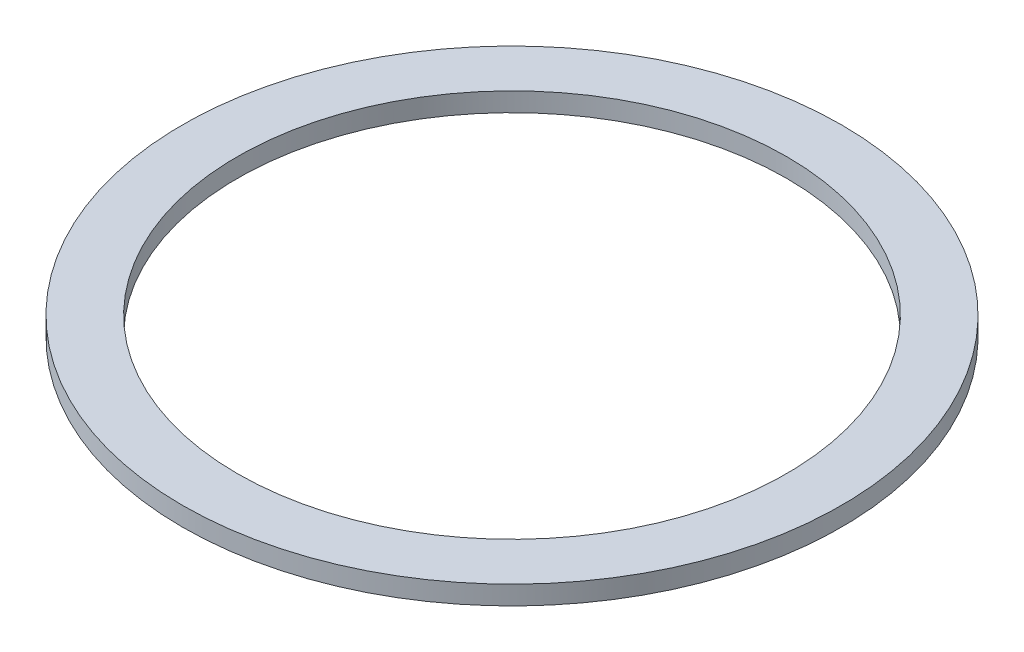
from build123d import *

# Parameters (mm, degrees)
SKETCH1_R           = 7.5
SKETCH1_R_2         = 6.25
BOSS_EXTRUDE1_DEPTH = 0.43


with BuildPart() as part:
    # Sketch1 → Boss-Extrude1 (new body)
    with BuildSketch(Plane(origin=(0, 0, 0), x_dir=(1, 0, 0), z_dir=(0, 1, 0))):
        Circle(SKETCH1_R)
        Circle(SKETCH1_R_2, mode=Mode.SUBTRACT)
    extrude(amount=BOSS_EXTRUDE1_DEPTH)


solid = part.part
